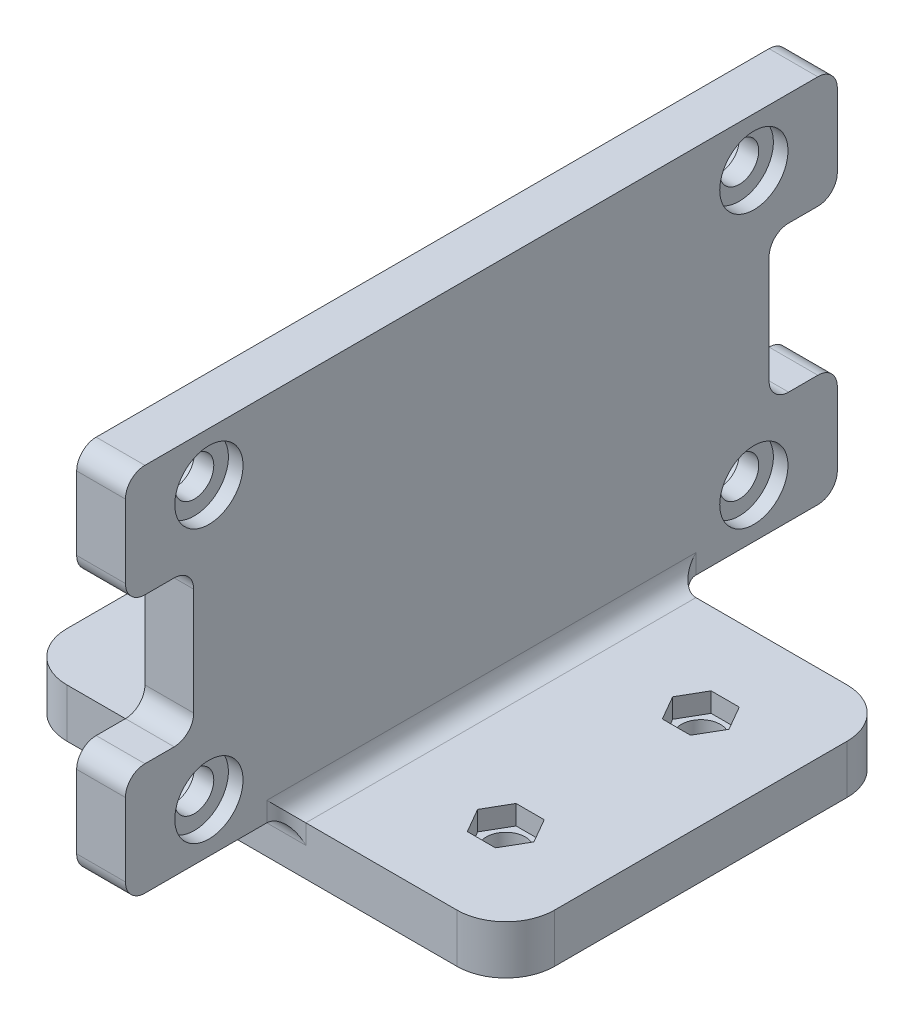
from build123d import *

# Parameters (mm, degrees)
ESQUISSE2_W             = 50
ESQUISSE2_H             = 40
BOSS_EXTRU_1_DEPTH      = 5
ESQUISSE3_W             = 73
ESQUISSE3_H             = 38
BOSS_EXTRU_2_DEPTH      = 2.5
ENL_V_MAT_EXTRU_1_REACH = 64.75
ESQUISSE4_R             = 2
ENL_V_MAT_EXTRU_2_REACH = 64.75
ESQUISSE5_W             = 7
ESQUISSE5_H             = 15
CONG_1_R                = 2
CONG_2_R                = 5
CONG_3_R                = 2
ENL_V_MAT_EXTRU_3_DEPTH = 2
ENL_V_MAT_EXTRU_4_REACH = 64.107
ESQUISSE7_R             = 3.5
ENL_V_MAT_EXTRU_5_REACH = 61.643
ESQUISSE8_R             = 2


with BuildPart() as part:
    # Esquisse2 → Boss.-Extru.1 (new body)
    with BuildSketch(Plane(origin=(0, 0, 0), x_dir=(1, 0, 0), z_dir=(0, 1, 0))):
        Rectangle(ESQUISSE2_W, ESQUISSE2_H)
    extrude(amount=BOSS_EXTRU_1_DEPTH)

    # Esquisse3 → Boss.-Extru.2 (add, symmetric)
    with BuildSketch(Plane(origin=(0, 0, 0), x_dir=(0, 0, -1), z_dir=(1, 0, 0))):
        with Locations((0, 24)):
            Rectangle(ESQUISSE3_W, ESQUISSE3_H)
    extrude(amount=BOSS_EXTRU_2_DEPTH, both=True)

    # Esquisse4 → Enlèv. mat.-Extru.1 (cut, up to next)
    with BuildSketch(Plane(origin=(2.5, 0, 0), x_dir=(0, 0, -1), z_dir=(1, 0, 0)), mode=Mode.PRIVATE) as enl_v_mat_extru_1_sk1:
        with Locations((-27.94, 37.97)):
            Circle(ESQUISSE4_R)
    enl_v_mat_extru_1_tool1 = extrude(enl_v_mat_extru_1_sk1.sketch, amount=-ENL_V_MAT_EXTRU_1_REACH, mode=Mode.PRIVATE) & part.part
    # Esquisse4 → Enlèv. mat.-Extru.1 (cut, up to next)
    with BuildSketch(Plane(origin=(2.5, 0, 0), x_dir=(0, 0, -1), z_dir=(1, 0, 0)), mode=Mode.PRIVATE) as enl_v_mat_extru_1_sk2:
        with Locations((-27.94, 10.03)):
            Circle(ESQUISSE4_R)
    enl_v_mat_extru_1_tool2 = extrude(enl_v_mat_extru_1_sk2.sketch, amount=-ENL_V_MAT_EXTRU_1_REACH, mode=Mode.PRIVATE) & part.part
    # Esquisse4 → Enlèv. mat.-Extru.1 (cut, up to next)
    with BuildSketch(Plane(origin=(2.5, 0, 0), x_dir=(0, 0, -1), z_dir=(1, 0, 0)), mode=Mode.PRIVATE) as enl_v_mat_extru_1_sk3:
        with Locations((27.94, 37.97)):
            Circle(ESQUISSE4_R)
    enl_v_mat_extru_1_tool3 = extrude(enl_v_mat_extru_1_sk3.sketch, amount=-ENL_V_MAT_EXTRU_1_REACH, mode=Mode.PRIVATE) & part.part
    # Esquisse4 → Enlèv. mat.-Extru.1 (cut, up to next)
    with BuildSketch(Plane(origin=(2.5, 0, 0), x_dir=(0, 0, -1), z_dir=(1, 0, 0)), mode=Mode.PRIVATE) as enl_v_mat_extru_1_sk4:
        with Locations((27.94, 10.03)):
            Circle(ESQUISSE4_R)
    enl_v_mat_extru_1_tool4 = extrude(enl_v_mat_extru_1_sk4.sketch, amount=-ENL_V_MAT_EXTRU_1_REACH, mode=Mode.PRIVATE) & part.part
    add(enl_v_mat_extru_1_tool1.solids().sort_by_distance((2.5, 37.97, 27.94))[0], mode=Mode.SUBTRACT)
    add(enl_v_mat_extru_1_tool2.solids().sort_by_distance((2.5, 10.03, 27.94))[0], mode=Mode.SUBTRACT)
    add(enl_v_mat_extru_1_tool3.solids().sort_by_distance((2.5, 37.97, -27.94))[0], mode=Mode.SUBTRACT)
    add(enl_v_mat_extru_1_tool4.solids().sort_by_distance((2.5, 10.03, -27.94))[0], mode=Mode.SUBTRACT)

    # Esquisse5 → Enlèv. mat.-Extru.2 (cut, up to next)
    with BuildSketch(Plane(origin=(2.5, 0, 0), x_dir=(0, 0, -1), z_dir=(1, 0, 0)), mode=Mode.PRIVATE) as enl_v_mat_extru_2_sk1:
        with Locations((-33, 24)):
            Rectangle(ESQUISSE5_W, ESQUISSE5_H)
    enl_v_mat_extru_2_tool1 = extrude(enl_v_mat_extru_2_sk1.sketch, amount=-ENL_V_MAT_EXTRU_2_REACH, mode=Mode.PRIVATE) & part.part
    # Esquisse5 → Enlèv. mat.-Extru.2 (cut, up to next)
    with BuildSketch(Plane(origin=(2.5, 0, 0), x_dir=(0, 0, -1), z_dir=(1, 0, 0)), mode=Mode.PRIVATE) as enl_v_mat_extru_2_sk2:
        with Locations((33, 24)):
            Rectangle(ESQUISSE5_W, ESQUISSE5_H)
    enl_v_mat_extru_2_tool2 = extrude(enl_v_mat_extru_2_sk2.sketch, amount=-ENL_V_MAT_EXTRU_2_REACH, mode=Mode.PRIVATE) & part.part
    add(enl_v_mat_extru_2_tool1.solids().sort_by_distance((2.5, 24, 33))[0], mode=Mode.SUBTRACT)
    add(enl_v_mat_extru_2_tool2.solids().sort_by_distance((2.5, 24, -33))[0], mode=Mode.SUBTRACT)

    # Congé1
    cong_1_edges = [part.edges().sort_by_distance(p)[0] for p in [
        (0, 16.5, -29.5),
        (0, 31.5, -29.5),
        (0, 16.5, 29.5),
        (0, 31.5, 29.5),
        (-2.5, 5, 0),
        (2.5, 5, 0),
    ]]
    fillet(cong_1_edges, radius=CONG_1_R)
    cong_1_2_edges = [part.edges().sort_by_distance(p)[0] for p in [
        (0, 5, -36.5),
        (0, 16.5, -36.5),
        (0, 43, -36.5),
        (0, 31.5, -36.5),
        (0, 5, 36.5),
        (0, 16.5, 36.5),
        (0, 31.5, 36.5),
        (0, 43, 36.5),
    ]]
    fillet(cong_1_2_edges, radius=CONG_1_R)

    # Congé2
    cong_2_edges = [part.edges().sort_by_distance(p)[0] for p in [
        (25, 2.5, 20),
        (-25, 2.5, 20),
        (-25, 2.5, -20),
        (25, 2.5, -20),
    ]]
    fillet(cong_2_edges, radius=CONG_2_R)

    # Congé3
    cong_3_edges = [part.edges().sort_by_distance(p)[0] for p in [
        (-2.5, 6, 20),
        (2.5, 6, 20),
        (0, 5, 20),
        (2.5, 6, -20),
        (-2.5, 6, -20),
        (0, 5, -20),
    ]]
    fillet(cong_3_edges, radius=CONG_3_R - 0.0001)  # a hair under: the kernel refuses the full size

    # Esquisse6 → Enlèv. mat.-Extru.3 (cut)
    with BuildSketch(Plane(origin=(0, 5, 0), x_dir=(1, 0, 0), z_dir=(0, 1, 0))):
        Polygon((-12.113248654, 10), (-13.556624327, 12.5), (-16.443375673, 12.5), (-17.886751346, 10), (-16.443375673, 7.5), (-13.556624327, 7.5), align=None)
        Polygon((-12.113248654, -10), (-13.556624327, -7.5), (-16.443375673, -7.5), (-17.886751346, -10), (-16.443375673, -12.5), (-13.556624327, -12.5), align=None)
        Polygon((13.556624327, -12.5), (12.113248654, -10), (13.556624327, -7.5), (16.443375673, -7.5), (17.886751346, -10), (16.443375673, -12.5), align=None)
        Polygon((13.556624327, 7.5), (12.113248654, 10), (13.556624327, 12.5), (16.443375673, 12.5), (17.886751346, 10), (16.443375673, 7.5), align=None)
    extrude(amount=-ENL_V_MAT_EXTRU_3_DEPTH, mode=Mode.SUBTRACT)

    # Esquisse7 → Enlèv. mat.-Extru.4 (cut, up to next)
    with BuildSketch(Plane.ZY.offset(1), mode=Mode.PRIVATE) as enl_v_mat_extru_4_sk1:
        with Locations((-27.94, 37.97)):
            Circle(ESQUISSE7_R)
    enl_v_mat_extru_4_tool1 = extrude(enl_v_mat_extru_4_sk1.sketch, amount=ENL_V_MAT_EXTRU_4_REACH, mode=Mode.PRIVATE) & part.part
    # Esquisse7 → Enlèv. mat.-Extru.4 (cut, up to next)
    with BuildSketch(Plane.ZY.offset(1), mode=Mode.PRIVATE) as enl_v_mat_extru_4_sk2:
        with Locations((-27.94, 10.03)):
            Circle(ESQUISSE7_R)
    enl_v_mat_extru_4_tool2 = extrude(enl_v_mat_extru_4_sk2.sketch, amount=ENL_V_MAT_EXTRU_4_REACH, mode=Mode.PRIVATE) & part.part
    # Esquisse7 → Enlèv. mat.-Extru.4 (cut, up to next)
    with BuildSketch(Plane.ZY.offset(1), mode=Mode.PRIVATE) as enl_v_mat_extru_4_sk3:
        with Locations((27.94, 37.97)):
            Circle(ESQUISSE7_R)
    enl_v_mat_extru_4_tool3 = extrude(enl_v_mat_extru_4_sk3.sketch, amount=ENL_V_MAT_EXTRU_4_REACH, mode=Mode.PRIVATE) & part.part
    # Esquisse7 → Enlèv. mat.-Extru.4 (cut, up to next)
    with BuildSketch(Plane.ZY.offset(1), mode=Mode.PRIVATE) as enl_v_mat_extru_4_sk4:
        with Locations((27.94, 10.03)):
            Circle(ESQUISSE7_R)
    enl_v_mat_extru_4_tool4 = extrude(enl_v_mat_extru_4_sk4.sketch, amount=ENL_V_MAT_EXTRU_4_REACH, mode=Mode.PRIVATE) & part.part
    enl_v_mat_extru_4_1 = enl_v_mat_extru_4_tool1.solids().sort_by_distance((-1, 37.97, -27.94))[0]
    add(enl_v_mat_extru_4_1, mode=Mode.SUBTRACT)
    enl_v_mat_extru_4_2 = enl_v_mat_extru_4_tool2.solids().sort_by_distance((-1, 10.03, -27.94))[0]
    add(enl_v_mat_extru_4_2, mode=Mode.SUBTRACT)
    enl_v_mat_extru_4_3 = enl_v_mat_extru_4_tool3.solids().sort_by_distance((-1, 37.97, 27.94))[0]
    add(enl_v_mat_extru_4_3, mode=Mode.SUBTRACT)
    enl_v_mat_extru_4_4 = enl_v_mat_extru_4_tool4.solids().sort_by_distance((-1, 10.03, 27.94))[0]
    add(enl_v_mat_extru_4_4, mode=Mode.SUBTRACT)
    enl_v_mat_extru_4 = enl_v_mat_extru_4_1 + enl_v_mat_extru_4_2 + enl_v_mat_extru_4_3 + enl_v_mat_extru_4_4  # Enlèv. mat.-Extru.4 as one shape, for the pattern or mirror that repeats it

    # Symétrie3: Enlèv. mat.-Extru.4 across plane
    add(enl_v_mat_extru_4.mirror(Plane(origin=(0, 0, 0), x_dir=(0, 0, 1), z_dir=(1, 0, 0))), mode=Mode.SUBTRACT)

    # Esquisse8 → Enlèv. mat.-Extru.5 (cut, up to next)
    with BuildSketch(Plane(origin=(0, 3, 0), x_dir=(1, 0, 0), z_dir=(0, 1, 0)), mode=Mode.PRIVATE) as enl_v_mat_extru_5_sk1:
        with Locations(Location((-15, 10, 0), (0, 0, 270))):
            Circle(ESQUISSE8_R)
    enl_v_mat_extru_5_tool1 = extrude(enl_v_mat_extru_5_sk1.sketch, amount=-ENL_V_MAT_EXTRU_5_REACH, mode=Mode.PRIVATE) & part.part
    # Esquisse8 → Enlèv. mat.-Extru.5 (cut, up to next)
    with BuildSketch(Plane(origin=(0, 3, 0), x_dir=(1, 0, 0), z_dir=(0, 1, 0)), mode=Mode.PRIVATE) as enl_v_mat_extru_5_sk2:
        with Locations(Location((-15, -10, 0), (0, 0, 270))):
            Circle(ESQUISSE8_R)
    enl_v_mat_extru_5_tool2 = extrude(enl_v_mat_extru_5_sk2.sketch, amount=-ENL_V_MAT_EXTRU_5_REACH, mode=Mode.PRIVATE) & part.part
    # Esquisse8 → Enlèv. mat.-Extru.5 (cut, up to next)
    with BuildSketch(Plane(origin=(0, 3, 0), x_dir=(1, 0, 0), z_dir=(0, 1, 0)), mode=Mode.PRIVATE) as enl_v_mat_extru_5_sk3:
        with Locations(Location((15, -10, 0), (0, 0, 270))):
            Circle(ESQUISSE8_R)
    enl_v_mat_extru_5_tool3 = extrude(enl_v_mat_extru_5_sk3.sketch, amount=-ENL_V_MAT_EXTRU_5_REACH, mode=Mode.PRIVATE) & part.part
    # Esquisse8 → Enlèv. mat.-Extru.5 (cut, up to next)
    with BuildSketch(Plane(origin=(0, 3, 0), x_dir=(1, 0, 0), z_dir=(0, 1, 0)), mode=Mode.PRIVATE) as enl_v_mat_extru_5_sk4:
        with Locations(Location((15, 10, 0), (0, 0, 270))):
            Circle(ESQUISSE8_R)
    enl_v_mat_extru_5_tool4 = extrude(enl_v_mat_extru_5_sk4.sketch, amount=-ENL_V_MAT_EXTRU_5_REACH, mode=Mode.PRIVATE) & part.part
    add(enl_v_mat_extru_5_tool1.solids().sort_by_distance((-15, 3, -10))[0], mode=Mode.SUBTRACT)
    add(enl_v_mat_extru_5_tool2.solids().sort_by_distance((-15, 3, 10))[0], mode=Mode.SUBTRACT)
    add(enl_v_mat_extru_5_tool3.solids().sort_by_distance((15, 3, 10))[0], mode=Mode.SUBTRACT)
    add(enl_v_mat_extru_5_tool4.solids().sort_by_distance((15, 3, -10))[0], mode=Mode.SUBTRACT)


solid = part.part
